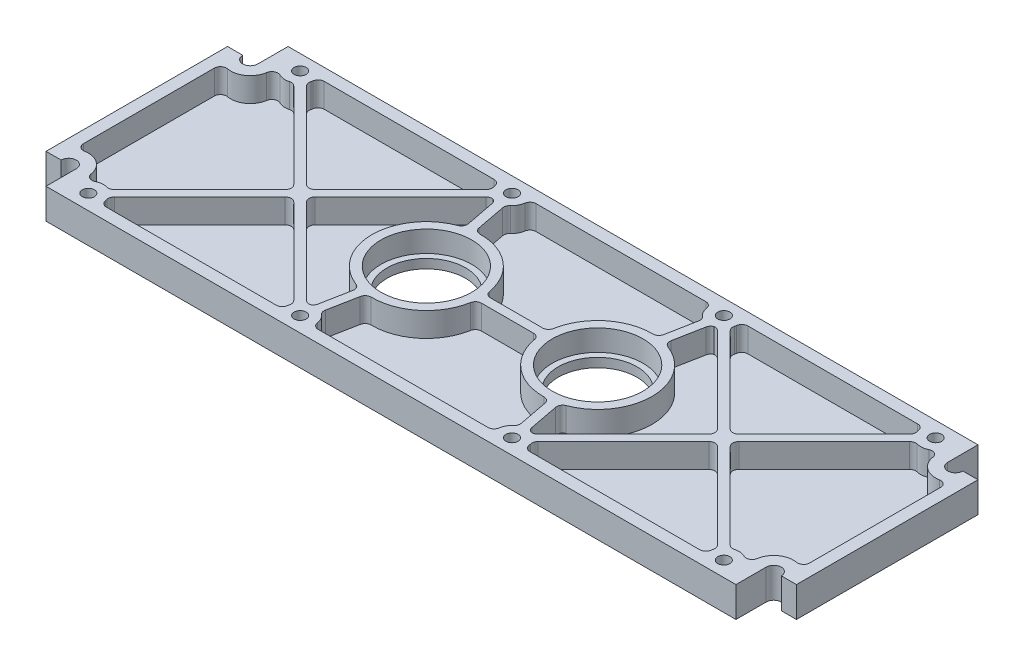
from build123d import *

# Parameters (mm, degrees)
SKETCH1_W      = 10
SKETCH1_H      = 60
SKETCH1_W_2    = 228
SKETCH1_H_2    = 80
EXTRUDE1_DEPTH = 5
SKETCH2_R      = 2
EXTRUDE2_DEPTH = 131.675169791
SKETCH3_R      = 13
EXTRUDE3_DEPTH = 131.675169791
SKETCH4_R      = 15
EXTRUDE4_DEPTH = 7
SKETCH5_R      = 2.5
EXTRUDE5_DEPTH = 131.675169791
EXTRUDE6_DEPTH = 8
FILLET1_START  = -4
FILLET1_DEPTH  = 9


with BuildPart() as part:
    # Sketch1 → Extrude1 (new, symmetric)
    with BuildSketch(Plane(origin=(0, 0, 0), x_dir=(1, 0, 0), z_dir=(0, 1, 0))):
        with Locations((-119, 0)):
            Rectangle(SKETCH1_W, SKETCH1_H)
        Rectangle(SKETCH1_W_2, SKETCH1_H_2)
        with Locations((119, 0)):
            Rectangle(SKETCH1_W, SKETCH1_H)
    extrude(amount=EXTRUDE1_DEPTH, both=True)

    # Sketch2 → Extrude2 (cut, through all)
    with BuildSketch(Plane(origin=(0, 5, 0), x_dir=(1, 0, 0), z_dir=(0, 1, 0))):
        with Locations(Location((-105, 35, 0), (0, 0, 270))):
            Circle(SKETCH2_R)
        with Locations(Location((-35, 35, 0), (0, 0, 270))):
            Circle(SKETCH2_R)
        with Locations(Location((35, 35, 0), (0, 0, 270))):
            Circle(SKETCH2_R)
        with Locations(Location((105, 35, 0), (0, 0, 270))):
            Circle(SKETCH2_R)
        with Locations(Location((105, -35, 0), (0, 0, 90))):
            Circle(SKETCH2_R)
        with Locations(Location((35, -35, 0), (0, 0, 90))):
            Circle(SKETCH2_R)
        with Locations(Location((-35, -35, 0), (0, 0, 90))):
            Circle(SKETCH2_R)
        with Locations(Location((-105, -35, 0), (0, 0, 90))):
            Circle(SKETCH2_R)
    extrude(amount=-EXTRUDE2_DEPTH, mode=Mode.SUBTRACT)

    # Sketch3 → Extrude3 (cut, through all)
    with BuildSketch(Plane(origin=(0, 5, 0), x_dir=(1, 0, 0), z_dir=(0, 1, 0))):
        with Locations(Location((-28.3, 0, 0), (0, 0, 270))):
            Circle(SKETCH3_R)
        with Locations(Location((28.3, 0, 0), (0, 0, 90))):
            Circle(SKETCH3_R)
    extrude(amount=-EXTRUDE3_DEPTH, mode=Mode.SUBTRACT)

    # Sketch4 → Extrude4 (cut)
    with BuildSketch(Plane(origin=(0, 5, 0), x_dir=(1, 0, 0), z_dir=(0, 1, 0))):
        with Locations(Location((28.3, 0, 0), (0, 0, 270))):
            Circle(SKETCH4_R)
        with Locations(Location((-28.3, 0, 0), (0, 0, 270))):
            Circle(SKETCH4_R)
    extrude(amount=-EXTRUDE4_DEPTH, mode=Mode.SUBTRACT)

    # Sketch5 → Extrude5 (cut, through all)
    with BuildSketch(Plane(origin=(0, 5, 0), x_dir=(1, 0, 0), z_dir=(0, 1, 0))):
        with Locations((116.5, -30)):
            Circle(SKETCH5_R)
        with Locations((116.5, 30)):
            Circle(SKETCH5_R)
        with Locations((-116.5, 30)):
            Circle(SKETCH5_R)
        with Locations((-116.5, -30)):
            Circle(SKETCH5_R)
    extrude(amount=-EXTRUDE5_DEPTH, mode=Mode.SUBTRACT)

    # Sketch6 → Extrude6 (cut)
    with BuildSketch(Plane(origin=(0, 5, 0), x_dir=(1, 0, 0), z_dir=(0, 1, 0))):
        with BuildLine():
            Line((100.566655437, -32.687975781), (70, -2.121320344))
            Line((70, -2.121320344), (39.433344563, -32.687975781))
            ThreePointArc((39.433344563, -32.687975781), (39.856270319, -33.809773722), (40, -35))
            ThreePointArc((40, -35), (39.974680765, -35.50254481), (39.898979486, -36))
            Line((39.898979486, -36), (100.101020514, -36))
            ThreePointArc((100.101020514, -36), (100.048692684, -34.303899534), (100.566655437, -32.687975781))
        make_face()
        with BuildLine():
            ThreePointArc((110, 35), (107.592284601, 30.724481254), (102.687975781, 30.566655437))
            Line((102.687975781, 30.566655437), (72.121320344, 0))
            Line((72.121320344, 0), (102.687975781, -30.566655437))
            ThreePointArc((102.687975781, -30.566655437), (107.592284601, -30.724481254), (110, -35))
            Line((110, -35), (110, -30))
            ThreePointArc((110, -30), (113.377501001, -24.299122875), (120, -24.522774425))
            Line((120, -24.522774425), (120, 24.522774425))
            ThreePointArc((120, 24.522774425), (113.377501001, 24.299122875), (110, 30))
            Line((110, 30), (110, 35))
        make_face()
        with BuildLine():
            Line((70, 2.121320344), (100.566655437, 32.687975781))
            ThreePointArc((100.566655437, 32.687975781), (100.048692684, 34.303899534), (100.101020514, 36))
            Line((100.101020514, 36), (39.898979486, 36))
            ThreePointArc((39.898979486, 36), (39.974680765, 35.50254481), (40, 35))
            ThreePointArc((40, 35), (39.856270319, 33.809773722), (39.433344563, 32.687975781))
            Line((39.433344563, 32.687975781), (70, 2.121320344))
        make_face()
        with BuildLine():
            Line((37.312024219, -30.566655437), (67.878679656, 0))
            Line((67.878679656, 0), (37.312024219, 30.566655437))
            ThreePointArc((37.312024219, 30.566655437), (36.468660758, 30.220561165), (35.576476478, 30.033343693))
            Line((35.576476478, 30.033343693), (33.14574211, 17.335477594))
            ThreePointArc((33.14574211, 17.335477594), (42.63916591, 10.880639733), (46.3, 0))
            ThreePointArc((46.3, 0), (42.63916591, -10.880639733), (33.14574211, -17.335477594))
            Line((33.14574211, -17.335477594), (35.576476478, -30.033343693))
            ThreePointArc((35.576476478, -30.033343693), (36.468660758, -30.220561165), (37.312024219, -30.566655437))
        make_face()
        with BuildLine():
            Line((-30.101020514, -36), (30.101020514, -36))
            ThreePointArc((30.101020514, -36), (30.471572993, -32.880247929), (32.629977821, -30.597387722))
            Line((32.629977821, -30.597387722), (30.199243454, -17.899521622))
            ThreePointArc((30.199243454, -17.899521622), (16.830840377, -13.872936875), (10.362608885, -1.5))
            Line((10.362608885, -1.5), (-10.362608885, -1.5))
            ThreePointArc((-10.362608885, -1.5), (-16.830840377, -13.872936875), (-30.199243454, -17.899521622))
            Line((-30.199243454, -17.899521622), (-32.629977821, -30.597387722))
            ThreePointArc((-32.629977821, -30.597387722), (-30.707558335, -32.435834531), (-30, -35))
            ThreePointArc((-30, -35), (-30.025319235, -35.50254481), (-30.101020514, -36))
        make_face()
        with BuildLine():
            ThreePointArc((32.629977821, 30.597387722), (30.471572993, 32.880247929), (30.101020514, 36))
            Line((30.101020514, 36), (-30.101020514, 36))
            ThreePointArc((-30.101020514, 36), (-30.025319235, 35.50254481), (-30, 35))
            ThreePointArc((-30, 35), (-30.707558335, 32.435834531), (-32.629977821, 30.597387722))
            Line((-32.629977821, 30.597387722), (-30.199243454, 17.899521622))
            ThreePointArc((-30.199243454, 17.899521622), (-16.830840377, 13.872936875), (-10.362608885, 1.5))
            Line((-10.362608885, 1.5), (10.362608885, 1.5))
            ThreePointArc((10.362608885, 1.5), (16.830840377, 13.872936875), (30.199243454, 17.899521622))
            Line((30.199243454, 17.899521622), (32.629977821, 30.597387722))
        make_face()
        with BuildLine():
            Line((-33.14574211, 17.335477594), (-35.576476478, 30.033343693))
            ThreePointArc((-35.576476478, 30.033343693), (-36.468660758, 30.220561165), (-37.312024219, 30.566655437))
            Line((-37.312024219, 30.566655437), (-67.878679656, 0))
            Line((-67.878679656, 0), (-37.312024219, -30.566655437))
            ThreePointArc((-37.312024219, -30.566655437), (-36.468660758, -30.220561165), (-35.576476478, -30.033343693))
            Line((-35.576476478, -30.033343693), (-33.14574211, -17.335477594))
            ThreePointArc((-33.14574211, -17.335477594), (-46.3, 0), (-33.14574211, 17.335477594))
        make_face()
        with BuildLine():
            Line((-100.101020514, -36), (-39.898979486, -36))
            ThreePointArc((-39.898979486, -36), (-39.951307316, -34.303899534), (-39.433344563, -32.687975781))
            Line((-39.433344563, -32.687975781), (-70, -2.121320344))
            Line((-70, -2.121320344), (-100.566655437, -32.687975781))
            ThreePointArc((-100.566655437, -32.687975781), (-100.143729681, -33.809773722), (-100, -35))
            ThreePointArc((-100, -35), (-100.025319235, -35.50254481), (-100.101020514, -36))
        make_face()
        with BuildLine():
            ThreePointArc((-102.687975781, 30.566655437), (-107.592284601, 30.724481254), (-110, 35))
            Line((-110, 35), (-110, 30))
            ThreePointArc((-110, 30), (-113.377501001, 24.299122875), (-120, 24.522774425))
            Line((-120, 24.522774425), (-120, -24.522774425))
            ThreePointArc((-120, -24.522774425), (-113.377501001, -24.299122875), (-110, -30))
            Line((-110, -30), (-110, -35))
            ThreePointArc((-110, -35), (-107.592284601, -30.724481254), (-102.687975781, -30.566655437))
            Line((-102.687975781, -30.566655437), (-72.121320344, 0))
            Line((-72.121320344, 0), (-102.687975781, 30.566655437))
        make_face()
        with BuildLine():
            ThreePointArc((-39.433344563, 32.687975781), (-39.951307316, 34.303899534), (-39.898979486, 36))
            Line((-39.898979486, 36), (-100.101020514, 36))
            ThreePointArc((-100.101020514, 36), (-100.025319235, 35.50254481), (-100, 35))
            ThreePointArc((-100, 35), (-100.143729681, 33.809773722), (-100.566655437, 32.687975781))
            Line((-100.566655437, 32.687975781), (-70, 2.121320344))
            Line((-70, 2.121320344), (-39.433344563, 32.687975781))
        make_face()
    extrude(amount=-EXTRUDE6_DEPTH, mode=Mode.SUBTRACT)

    # Fillet1: read off the stored shape, not the designer's step
    # Fillet1 outline → Fillet1 (add)
    with BuildSketch(Plane(origin=(0, 0, 0), x_dir=(1, 0, 0), z_dir=(0, 1, 0)).offset(FILLET1_START)):
        with BuildLine():
            ThreePointArc((10.577768199, 3.15), (9.89315459, 1.967029028), (8.608631332, 1.5))
            Line((8.608631332, 1.5), (10.362608885, 1.5))
            ThreePointArc((10.362608885, 1.5), (10.451112034, 2.327487569), (10.577768199, 3.15))
        make_face()
        with BuildLine():
            Line((-10.362608885, 1.5), (-8.608631332, 1.5))
            ThreePointArc((-8.608631332, 1.5), (-9.89315459, 1.967029028), (-10.577768199, 3.15))
            ThreePointArc((-10.577768199, 3.15), (-10.451112034, 2.327487569), (-10.362608885, 1.5))
        make_face()
        with BuildLine():
            ThreePointArc((30.529016975, 19.622219123), (29.828807616, 18.448412084), (28.538216084, 17.998423628))
            ThreePointArc((28.538216084, 17.998423628), (29.369873227, 17.968176626), (30.199243454, 17.899521622))
            Line((30.199243454, 17.899521622), (30.529016975, 19.622219123))
        make_face()
        with BuildLine():
            ThreePointArc((-30.199243454, 17.899521622), (-29.369873227, 17.968176626), (-28.538216084, 17.998423628))
            ThreePointArc((-28.538216084, 17.998423628), (-29.828807616, 18.448412084), (-30.529016975, 19.622219123))
            Line((-30.529016975, 19.622219123), (-30.199243454, 17.899521622))
        make_face()
        with BuildLine():
            ThreePointArc((31.730457023, 31.217132209), (32.311816302, 30.36050034), (32.386972271, 29.32795574))
            Line((32.386972271, 29.32795574), (32.629977821, 30.597387722))
            ThreePointArc((32.629977821, 30.597387722), (32.163242239, 30.882621537), (31.730457023, 31.217132209))
        make_face()
        with BuildLine():
            Line((-32.629977821, 30.597387722), (-32.386972271, 29.32795574))
            ThreePointArc((-32.386972271, 29.32795574), (-32.311816302, 30.36050034), (-31.730457023, 31.217132209))
            ThreePointArc((-31.730457023, 31.217132209), (-32.163242239, 30.882621537), (-32.629977821, 30.597387722))
        make_face()
        with BuildLine():
            ThreePointArc((28.07179677, 36), (29.381104111, 35.511857892), (30.051283407, 34.285714286))
            ThreePointArc((30.051283407, 34.285714286), (30.002103103, 35.145005546), (30.101020514, 36))
            Line((30.101020514, 36), (28.07179677, 36))
        make_face()
        with BuildLine():
            ThreePointArc((-30.101020514, 36), (-30.002103103, 35.145005546), (-30.051283407, 34.285714286))
            ThreePointArc((-30.051283407, 34.285714286), (-29.381104111, 35.511857892), (-28.07179677, 36))
            Line((-28.07179677, 36), (-30.101020514, 36))
        make_face()
        with BuildLine():
            ThreePointArc((-38.225946878, 29.652732778), (-37.416838722, 30.14478453), (-36.472070331, 30.20946545))
            ThreePointArc((-36.472070331, 30.20946545), (-35.726650051, 29.625411051), (-35.333470927, 28.763911712))
            Line((-35.333470927, 28.763911712), (-35.576476478, 30.033343693))
            ThreePointArc((-35.576476478, 30.033343693), (-36.468660758, 30.220561165), (-37.312024219, 30.566655437))
            Line((-37.312024219, 30.566655437), (-38.225946878, 29.652732778))
        make_face()
        with BuildLine():
            ThreePointArc((-66.464466094, -1.414213562), (-67.050252532, 0), (-66.464466094, 1.414213562))
            Line((-66.464466094, 1.414213562), (-67.878679656, 0))
            Line((-67.878679656, 0), (-66.464466094, -1.414213562))
        make_face()
        with BuildLine():
            Line((-33.14574211, 17.335477594), (-33.475515632, 19.058175095))
            ThreePointArc((-33.475515632, 19.058175095), (-33.692706543, 17.708751432), (-34.725863263, 16.813931168))
            ThreePointArc((-34.725863263, 16.813931168), (-33.941832556, 17.092972984), (-33.14574211, 17.335477594))
        make_face()
        with BuildLine():
            ThreePointArc((-36.472070331, -30.20946545), (-37.416838722, -30.14478453), (-38.225946878, -29.652732778))
            Line((-38.225946878, -29.652732778), (-37.312024219, -30.566655437))
            ThreePointArc((-37.312024219, -30.566655437), (-36.468660758, -30.220561165), (-35.576476478, -30.033343693))
            Line((-35.576476478, -30.033343693), (-35.333470927, -28.763911712))
            ThreePointArc((-35.333470927, -28.763911712), (-35.726650051, -29.625411051), (-36.472070331, -30.20946545))
        make_face()
        with BuildLine():
            ThreePointArc((-33.14574211, -17.335477594), (-33.941832556, -17.092972984), (-34.725863263, -16.813931168))
            ThreePointArc((-34.725863263, -16.813931168), (-33.692706543, -17.708751432), (-33.475515632, -19.058175095))
            Line((-33.475515632, -19.058175095), (-33.14574211, -17.335477594))
        make_face()
        with BuildLine():
            ThreePointArc((-120, 21.633399735), (-119.283377896, 23.167329712), (-117.647058824, 23.602011562))
            ThreePointArc((-117.647058824, 23.602011562), (-118.868700063, 23.946962745), (-120, 24.522774425))
            Line((-120, 24.522774425), (-120, 21.633399735))
        make_face()
        with BuildLine():
            ThreePointArc((-110, 30), (-110.018493581, 29.510025982), (-110.073869089, 29.02284008))
            ThreePointArc((-110.073869089, 29.02284008), (-109.021620572, 30.495402298), (-107.211855742, 30.515839635))
            ThreePointArc((-107.211855742, 30.515839635), (-109.246132282, 32.359855942), (-110, 35))
            Line((-110, 35), (-110, 30))
        make_face()
        with BuildLine():
            ThreePointArc((-117.647058824, -23.602011562), (-119.283377896, -23.167329712), (-120, -21.633399735))
            Line((-120, -21.633399735), (-120, -24.522774425))
            ThreePointArc((-120, -24.522774425), (-118.868700063, -23.946962745), (-117.647058824, -23.602011562))
        make_face()
        with BuildLine():
            ThreePointArc((-102.687975781, 30.566655437), (-103.186085799, 30.340631451), (-103.705904774, 30.170370868))
            ThreePointArc((-103.705904774, 30.170370868), (-102.670628594, 30.170370869), (-101.774053122, 29.652732778))
            Line((-101.774053122, 29.652732778), (-102.687975781, 30.566655437))
        make_face()
        with BuildLine():
            ThreePointArc((-107.211855742, -30.515839635), (-109.021620572, -30.495402298), (-110.073869089, -29.02284008))
            ThreePointArc((-110.073869089, -29.02284008), (-110.018493581, -29.510025982), (-110, -30))
            Line((-110, -30), (-110, -35))
            ThreePointArc((-110, -35), (-109.246132282, -32.359855942), (-107.211855742, -30.515839635))
        make_face()
        with BuildLine():
            Line((-72.121320344, 0), (-73.535533906, 1.414213562))
            ThreePointArc((-73.535533906, 1.414213562), (-72.949747468, 0), (-73.535533906, -1.414213562))
            Line((-73.535533906, -1.414213562), (-72.121320344, 0))
        make_face()
        with BuildLine():
            ThreePointArc((-101.774053122, -29.652732778), (-102.670628594, -30.170370869), (-103.705904774, -30.170370869))
            ThreePointArc((-103.705904774, -30.170370869), (-103.186085799, -30.340631451), (-102.687975781, -30.566655437))
            Line((-102.687975781, -30.566655437), (-101.774053122, -29.652732778))
        make_face()
        with BuildLine():
            ThreePointArc((-39.948716593, -34.285714286), (-40.618895889, -35.511857892), (-41.92820323, -36))
            Line((-41.92820323, -36), (-39.898979486, -36))
            ThreePointArc((-39.898979486, -36), (-39.997896897, -35.145005546), (-39.948716593, -34.285714286))
        make_face()
        with BuildLine():
            Line((-100.101020514, -36), (-98.07179677, -36))
            ThreePointArc((-98.07179677, -36), (-99.381104111, -35.511857892), (-100.051283407, -34.285714286))
            ThreePointArc((-100.051283407, -34.285714286), (-100.002103103, -35.145005546), (-100.101020514, -36))
        make_face()
        with BuildLine():
            ThreePointArc((-40.347267222, -31.774053122), (-39.829629131, -32.670628594), (-39.829629131, -33.705904774))
            ThreePointArc((-39.829629131, -33.705904774), (-39.659368549, -33.186085799), (-39.433344563, -32.687975781))
            Line((-39.433344563, -32.687975781), (-40.347267222, -31.774053122))
        make_face()
        with BuildLine():
            ThreePointArc((-100.566655437, -32.687975781), (-100.340631451, -33.186085799), (-100.170370869, -33.705904774))
            ThreePointArc((-100.170370869, -33.705904774), (-100.170370869, -32.670628594), (-99.652732778, -31.774053122))
            Line((-99.652732778, -31.774053122), (-100.566655437, -32.687975781))
        make_face()
        with BuildLine():
            ThreePointArc((-71.414213562, -3.535533906), (-70, -2.949747468), (-68.585786438, -3.535533906))
            Line((-68.585786438, -3.535533906), (-70, -2.121320344))
            Line((-70, -2.121320344), (-71.414213562, -3.535533906))
        make_face()
        with BuildLine():
            ThreePointArc((39.948716593, 34.285714286), (40.618895889, 35.511857892), (41.92820323, 36))
            Line((41.92820323, 36), (39.898979486, 36))
            ThreePointArc((39.898979486, 36), (39.997896897, 35.145005546), (39.948716593, 34.285714286))
        make_face()
        with BuildLine():
            Line((100.101020514, 36), (98.07179677, 36))
            ThreePointArc((98.07179677, 36), (99.381104111, 35.511857892), (100.051283407, 34.285714286))
            ThreePointArc((100.051283407, 34.285714286), (100.002103103, 35.145005546), (100.101020514, 36))
        make_face()
        with BuildLine():
            ThreePointArc((40.347267222, 31.774053122), (39.829629131, 32.670628594), (39.829629131, 33.705904774))
            ThreePointArc((39.829629131, 33.705904774), (39.659368549, 33.186085799), (39.433344563, 32.687975781))
            Line((39.433344563, 32.687975781), (40.347267222, 31.774053122))
        make_face()
        with BuildLine():
            ThreePointArc((100.566655437, 32.687975781), (100.340631451, 33.186085799), (100.170370869, 33.705904774))
            ThreePointArc((100.170370869, 33.705904774), (100.170370869, 32.670628594), (99.652732778, 31.774053122))
            Line((99.652732778, 31.774053122), (100.566655437, 32.687975781))
        make_face()
        with BuildLine():
            ThreePointArc((71.414213562, 3.535533906), (70, 2.949747468), (68.585786438, 3.535533906))
            Line((68.585786438, 3.535533906), (70, 2.121320344))
            Line((70, 2.121320344), (71.414213562, 3.535533906))
        make_face()
        with BuildLine():
            Line((72.121320344, 0), (73.535533906, -1.414213562))
            ThreePointArc((73.535533906, -1.414213562), (72.949747468, 0), (73.535533906, 1.414213562))
            Line((73.535533906, 1.414213562), (72.121320344, 0))
        make_face()
        with BuildLine():
            ThreePointArc((103.705904774, -30.170370869), (102.670628594, -30.170370869), (101.774053122, -29.652732778))
            Line((101.774053122, -29.652732778), (102.687975781, -30.566655437))
            ThreePointArc((102.687975781, -30.566655437), (103.186085799, -30.340631451), (103.705904774, -30.170370869))
        make_face()
        with BuildLine():
            Line((102.687975781, 30.566655437), (101.774053122, 29.652732778))
            ThreePointArc((101.774053122, 29.652732778), (102.670628594, 30.170370869), (103.705904774, 30.170370869))
            ThreePointArc((103.705904774, 30.170370869), (103.186085799, 30.340631451), (102.687975781, 30.566655437))
        make_face()
        with BuildLine():
            ThreePointArc((110.073869089, -29.02284008), (109.021620572, -30.495402298), (107.211855742, -30.515839635))
            ThreePointArc((107.211855742, -30.515839635), (109.246132282, -32.359855942), (110, -35))
            Line((110, -35), (110, -30))
            ThreePointArc((110, -30), (110.018493581, -29.510025982), (110.073869089, -29.02284008))
        make_face()
        with BuildLine():
            ThreePointArc((110, 35), (109.246132282, 32.359855942), (107.211855742, 30.515839635))
            ThreePointArc((107.211855742, 30.515839635), (109.021620572, 30.495402298), (110.073869089, 29.02284008))
            ThreePointArc((110.073869089, 29.02284008), (110.018493581, 29.510025982), (110, 30))
            Line((110, 30), (110, 35))
        make_face()
        with BuildLine():
            ThreePointArc((120, -21.633399735), (119.283377896, -23.167329712), (117.647058824, -23.602011562))
            ThreePointArc((117.647058824, -23.602011562), (118.868700063, -23.946962745), (120, -24.522774425))
            Line((120, -24.522774425), (120, -21.633399735))
        make_face()
        with BuildLine():
            ThreePointArc((120, 24.522774425), (118.868700063, 23.946962745), (117.647058824, 23.602011562))
            ThreePointArc((117.647058824, 23.602011562), (119.283377896, 23.167329712), (120, 21.633399735))
            Line((120, 21.633399735), (120, 24.522774425))
        make_face()
        with BuildLine():
            ThreePointArc((38.225946878, -29.652732778), (37.416838722, -30.14478453), (36.472070331, -30.20946545))
            ThreePointArc((36.472070331, -30.20946545), (35.726650051, -29.625411051), (35.333470927, -28.763911712))
            Line((35.333470927, -28.763911712), (35.576476478, -30.033343693))
            ThreePointArc((35.576476478, -30.033343693), (36.468660758, -30.220561165), (37.312024219, -30.566655437))
            Line((37.312024219, -30.566655437), (38.225946878, -29.652732778))
        make_face()
        with BuildLine():
            ThreePointArc((66.464466094, 1.414213562), (67.050252532, 0), (66.464466094, -1.414213562))
            Line((66.464466094, -1.414213562), (67.878679656, 0))
            Line((67.878679656, 0), (66.464466094, 1.414213562))
        make_face()
        with BuildLine():
            Line((33.14574211, -17.335477594), (33.475515632, -19.058175095))
            ThreePointArc((33.475515632, -19.058175095), (33.692706543, -17.708751432), (34.725863263, -16.813931168))
            ThreePointArc((34.725863263, -16.813931168), (33.941832556, -17.092972984), (33.14574211, -17.335477594))
        make_face()
        with BuildLine():
            ThreePointArc((36.472070331, 30.20946545), (37.416838722, 30.14478453), (38.225946878, 29.652732778))
            Line((38.225946878, 29.652732778), (37.312024219, 30.566655437))
            ThreePointArc((37.312024219, 30.566655437), (36.468660758, 30.220561165), (35.576476478, 30.033343693))
            Line((35.576476478, 30.033343693), (35.333470927, 28.763911712))
            ThreePointArc((35.333470927, 28.763911712), (35.726650051, 29.625411051), (36.472070331, 30.20946545))
        make_face()
        with BuildLine():
            ThreePointArc((33.14574211, 17.335477594), (33.941832556, 17.092972984), (34.725863263, 16.813931168))
            ThreePointArc((34.725863263, 16.813931168), (33.692706543, 17.708751432), (33.475515632, 19.058175095))
            Line((33.475515632, 19.058175095), (33.14574211, 17.335477594))
        make_face()
        with BuildLine():
            ThreePointArc((-31.730457023, -31.217132209), (-32.311816302, -30.36050034), (-32.386972271, -29.32795574))
            Line((-32.386972271, -29.32795574), (-32.629977821, -30.597387722))
            ThreePointArc((-32.629977821, -30.597387722), (-32.163242239, -30.882621537), (-31.730457023, -31.217132209))
        make_face()
        with BuildLine():
            Line((-30.199243454, -17.899521622), (-30.529016975, -19.622219123))
            ThreePointArc((-30.529016975, -19.622219123), (-29.828807616, -18.448412084), (-28.538216084, -17.998423628))
            ThreePointArc((-28.538216084, -17.998423628), (-29.369873227, -17.968176626), (-30.199243454, -17.899521622))
        make_face()
        with BuildLine():
            ThreePointArc((-28.07179677, -36), (-29.381104111, -35.511857892), (-30.051283407, -34.285714286))
            ThreePointArc((-30.051283407, -34.285714286), (-30.002103103, -35.145005546), (-30.101020514, -36))
            Line((-30.101020514, -36), (-28.07179677, -36))
        make_face()
        with BuildLine():
            ThreePointArc((-10.362608885, -1.5), (-10.451112034, -2.327487569), (-10.577768199, -3.15))
            ThreePointArc((-10.577768199, -3.15), (-9.89315459, -1.967029028), (-8.608631332, -1.5))
            Line((-8.608631332, -1.5), (-10.362608885, -1.5))
        make_face()
        with BuildLine():
            ThreePointArc((30.051283407, -34.285714286), (29.381104111, -35.511857892), (28.07179677, -36))
            Line((28.07179677, -36), (30.101020514, -36))
            ThreePointArc((30.101020514, -36), (30.002103103, -35.145005546), (30.051283407, -34.285714286))
        make_face()
        with BuildLine():
            Line((10.362608885, -1.5), (8.608631332, -1.5))
            ThreePointArc((8.608631332, -1.5), (9.89315459, -1.967029028), (10.577768199, -3.15))
            ThreePointArc((10.577768199, -3.15), (10.451112034, -2.327487569), (10.362608885, -1.5))
        make_face()
        with BuildLine():
            ThreePointArc((32.386972271, -29.32795574), (32.311816302, -30.36050034), (31.730457023, -31.217132209))
            ThreePointArc((31.730457023, -31.217132209), (32.163242239, -30.882621537), (32.629977821, -30.597387722))
            Line((32.629977821, -30.597387722), (32.386972271, -29.32795574))
        make_face()
        with BuildLine():
            ThreePointArc((30.199243454, -17.899521622), (29.369873227, -17.968176626), (28.538216084, -17.998423628))
            ThreePointArc((28.538216084, -17.998423628), (29.828807616, -18.448412084), (30.529016975, -19.622219123))
            Line((30.529016975, -19.622219123), (30.199243454, -17.899521622))
        make_face()
        with BuildLine():
            ThreePointArc((-100.051283407, 34.285714286), (-99.381104111, 35.511857892), (-98.07179677, 36))
            Line((-98.07179677, 36), (-100.101020514, 36))
            ThreePointArc((-100.101020514, 36), (-100.002103103, 35.145005546), (-100.051283407, 34.285714286))
        make_face()
        with BuildLine():
            Line((-39.898979486, 36), (-41.92820323, 36))
            ThreePointArc((-41.92820323, 36), (-40.618895889, 35.511857892), (-39.948716593, 34.285714286))
            ThreePointArc((-39.948716593, 34.285714286), (-39.997896897, 35.145005546), (-39.898979486, 36))
        make_face()
        with BuildLine():
            ThreePointArc((-99.652732778, 31.774053122), (-100.170370869, 32.670628594), (-100.170370869, 33.705904774))
            ThreePointArc((-100.170370869, 33.705904774), (-100.340631451, 33.186085799), (-100.566655437, 32.687975781))
            Line((-100.566655437, 32.687975781), (-99.652732778, 31.774053122))
        make_face()
        with BuildLine():
            ThreePointArc((-39.433344563, 32.687975781), (-39.659368549, 33.186085799), (-39.829629131, 33.705904774))
            ThreePointArc((-39.829629131, 33.705904774), (-39.829629131, 32.670628594), (-40.347267222, 31.774053122))
            Line((-40.347267222, 31.774053122), (-39.433344563, 32.687975781))
        make_face()
        with BuildLine():
            ThreePointArc((-68.585786438, 3.535533906), (-70, 2.949747468), (-71.414213562, 3.535533906))
            Line((-71.414213562, 3.535533906), (-70, 2.121320344))
            Line((-70, 2.121320344), (-68.585786438, 3.535533906))
        make_face()
        with BuildLine():
            ThreePointArc((100.051283407, -34.285714286), (99.381104111, -35.511857892), (98.07179677, -36))
            Line((98.07179677, -36), (100.101020514, -36))
            ThreePointArc((100.101020514, -36), (100.002103103, -35.145005546), (100.051283407, -34.285714286))
        make_face()
        with BuildLine():
            Line((39.898979486, -36), (41.92820323, -36))
            ThreePointArc((41.92820323, -36), (40.618895889, -35.511857892), (39.948716593, -34.285714286))
            ThreePointArc((39.948716593, -34.285714286), (39.997896897, -35.145005546), (39.898979486, -36))
        make_face()
        with BuildLine():
            ThreePointArc((99.652732778, -31.774053122), (100.170370869, -32.670628594), (100.170370869, -33.705904774))
            ThreePointArc((100.170370869, -33.705904774), (100.340631451, -33.186085799), (100.566655437, -32.687975781))
            Line((100.566655437, -32.687975781), (99.652732778, -31.774053122))
        make_face()
        with BuildLine():
            ThreePointArc((39.433344563, -32.687975781), (39.659368549, -33.186085799), (39.829629131, -33.705904774))
            ThreePointArc((39.829629131, -33.705904774), (39.829629131, -32.670628594), (40.347267222, -31.774053122))
            Line((40.347267222, -31.774053122), (39.433344563, -32.687975781))
        make_face()
        with BuildLine():
            ThreePointArc((68.585786438, -3.535533906), (70, -2.949747468), (71.414213562, -3.535533906))
            Line((71.414213562, -3.535533906), (70, -2.121320344))
            Line((70, -2.121320344), (68.585786438, -3.535533906))
        make_face()
    extrude(amount=FILLET1_DEPTH)


solid = part.part
